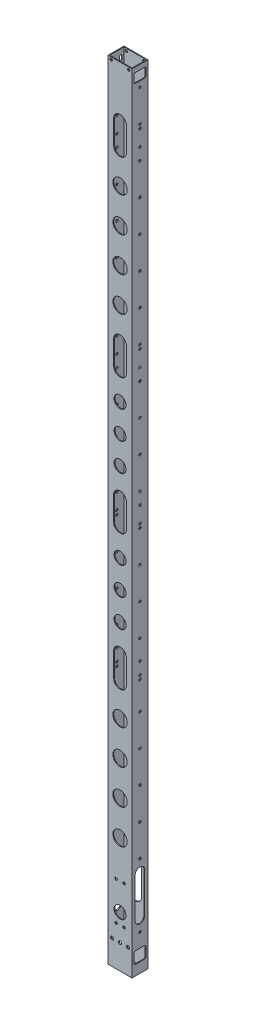
from build123d import *

# Parameters (mm, degrees)
SKETCH_1_W           = 30
SKETCH_1_H           = 20
SKETCH_1_W_2         = 28
SKETCH_1_H_2         = 18
EXTRUDE_1_DEPTH      = 980
SKETCH_3_R           = 1.5
CUT_EXTRUDE_2_DEPTH  = 981.51007134
CUT_EXTRUDE_3_DEPTH  = 981.51007134
SKETCH_5_W           = 15
SKETCH_5_H           = 12
CUT_EXTRUDE_4_DEPTH  = 10
SKETCH_6_R           = 9
SKETCH_6_R_2         = 7.5
CUT_EXTRUDE_5_DEPTH  = 981.318825689
SKETCH_9_R           = 1.5
CUT_EXTRUDE_7_DEPTH  = 981.318825689
SKETCH_13_W          = 30
SKETCH_13_H          = 20
SKETCH_13_W_2        = 28
SKETCH_13_H_2        = 18
EXTRUDE_2_DEPTH      = 10
CUT_EXTRUDE_8_DEPTH  = 60
SKETCH_15_W          = 15
SKETCH_15_H          = 15
CUT_EXTRUDE_10_DEPTH = 5
FILLET_1_R           = 2
SKETCH_16_R          = 2
CUT_EXTRUDE_11_DEPTH = 90
FILLET_2_R           = 2
SKETCH_17_R          = 1.5
CUT_EXTRUDE_12_DEPTH = 40
CUT_EXTRUDE_15_DEPTH = 51
SKETCH_21_W          = 22.187259215
SKETCH_21_H          = 65.33837704
EXTRUDE_3_DEPTH      = 1
SKETCH_22_R          = 1.65
CUT_EXTRUDE_16_DEPTH = 1
SKETCH_23_R          = 7.5
CUT_EXTRUDE_17_DEPTH = 10


with BuildPart() as part:
    # 草图1 → 凸台-拉伸1 (new body)
    with BuildSketch(Plane(origin=(0, 0, 0), x_dir=(1, 0, 0), z_dir=(0, 1, 0))):
        Rectangle(SKETCH_1_W, SKETCH_1_H)
        Rectangle(SKETCH_1_W_2, SKETCH_1_H_2, mode=Mode.SUBTRACT)
    extrude(amount=EXTRUDE_1_DEPTH)

    # 草图3 → 切除-拉伸2 (cut, through all)
    with BuildSketch(Plane(origin=(15, 0, 0), x_dir=(0, 0, -1), z_dir=(1, 0, 0))):
        with Locations((0, 890)):
            Circle(SKETCH_3_R)
        with Locations((0, 910)):
            Circle(SKETCH_3_R)
        with Locations((0, 500)):
            Circle(SKETCH_3_R)
        with Locations((0, 480)):
            Circle(SKETCH_3_R)
        with Locations((0, 670)):
            Circle(SKETCH_3_R)
        with Locations((0, 650)):
            Circle(SKETCH_3_R)
        with Locations((0, 330)):
            Circle(SKETCH_3_R)
        with Locations((0, 310)):
            Circle(SKETCH_3_R)
        with Locations((0, 70)):
            Circle(SKETCH_3_R)
        with Locations((0, 90)):
            Circle(SKETCH_3_R)
    extrude(amount=-CUT_EXTRUDE_2_DEPTH, mode=Mode.SUBTRACT)

    # 草图4 → 切除-拉伸3 (cut, through all)
    with BuildSketch(Plane(origin=(15, 0, 0), x_dir=(0, 0, -1), z_dir=(1, 0, 0))):
        with BuildLine():
            Line((3.4, 968), (3.4, 972))
            ThreePointArc((3.4, 972), (5, 973.6), (6.6, 972))
            Line((6.6, 972), (6.6, 968))
            ThreePointArc((6.6, 968), (5, 966.4), (3.4, 968))
        make_face()
        with BuildLine():
            Line((-3.4, 968), (-3.4, 972))
            ThreePointArc((-3.4, 972), (-5, 973.6), (-6.6, 972))
            Line((-6.6, 972), (-6.6, 968))
            ThreePointArc((-6.6, 968), (-5, 966.4), (-3.4, 968))
        make_face()
    extrude(amount=-CUT_EXTRUDE_3_DEPTH, mode=Mode.SUBTRACT)

    # 草图5 → 切除-拉伸4 (cut)
    with BuildSketch(Plane(origin=(15, 0, 0), x_dir=(0, 0, -1), z_dir=(1, 0, 0))):
        with Locations((0, 968)):
            Rectangle(SKETCH_5_W, SKETCH_5_H)
    extrude(amount=-CUT_EXTRUDE_4_DEPTH, mode=Mode.SUBTRACT)

    # 草图6 → 切除-拉伸5 (cut, through all)
    with BuildSketch(Plane(origin=(0, 0, -10), x_dir=(-1, 0, 0), z_dir=(0, 0, -1))):
        with Locations((0, 135)):
            Circle(SKETCH_6_R)
        with Locations((0, 178.333333333)):
            Circle(SKETCH_6_R)
        with Locations((0, 221.666666667)):
            Circle(SKETCH_6_R)
        with Locations((0, 265)):
            Circle(SKETCH_6_R)
        with Locations((0, 845)):
            Circle(SKETCH_6_R)
        with Locations((0, 801.666666667)):
            Circle(SKETCH_6_R)
        with Locations((0, 758.333333333)):
            Circle(SKETCH_6_R)
        with Locations((0, 715)):
            Circle(SKETCH_6_R)
        with Locations((0, 440)):
            Circle(SKETCH_6_R_2)
        with Locations((0, 405)):
            Circle(SKETCH_6_R_2)
        with Locations((0, 370)):
            Circle(SKETCH_6_R_2)
        with Locations((0, 610)):
            Circle(SKETCH_6_R_2)
        with Locations((0, 575)):
            Circle(SKETCH_6_R_2)
        with Locations((0, 540)):
            Circle(SKETCH_6_R_2)
        with BuildLine():
            Line((-8, 65), (-8, 95))
            ThreePointArc((-8, 95), (0, 103), (8, 95))
            Line((8, 95), (8, 65))
            ThreePointArc((8, 65), (0, 57), (-8, 65))
        make_face()
        with BuildLine():
            Line((-8, 305), (-8, 335))
            ThreePointArc((-8, 335), (0, 343), (8, 335))
            Line((8, 335), (8, 305))
            ThreePointArc((8, 305), (0, 297), (-8, 305))
        make_face()
        with BuildLine():
            Line((-8, 475), (-8, 505))
            ThreePointArc((-8, 505), (0, 513), (8, 505))
            Line((8, 505), (8, 475))
            ThreePointArc((8, 475), (0, 467), (-8, 475))
        make_face()
        with BuildLine():
            Line((-8, 645), (-8, 675))
            ThreePointArc((-8, 675), (0, 683), (8, 675))
            Line((8, 675), (8, 645))
            ThreePointArc((8, 645), (0, 637), (-8, 645))
        make_face()
        with BuildLine():
            Line((-8, 885), (-8, 915))
            ThreePointArc((-8, 915), (0, 923), (8, 915))
            Line((8, 915), (8, 885))
            ThreePointArc((8, 885), (0, 877), (-8, 885))
        make_face()
    extrude(amount=-CUT_EXTRUDE_5_DEPTH, mode=Mode.SUBTRACT)

    # 草图9 → 切除-拉伸7 (cut, through all)
    with BuildSketch(Plane.XY.offset(10)):
        with Locations((11, 977)):
            Circle(SKETCH_9_R)
        with Locations((-11, 977)):
            Circle(SKETCH_9_R)
    extrude(amount=-CUT_EXTRUDE_7_DEPTH, mode=Mode.SUBTRACT)

    # 草图13 → 凸台-拉伸2 (add)
    with BuildSketch(Plane.XZ):
        Rectangle(SKETCH_13_W, SKETCH_13_H)
        Rectangle(SKETCH_13_W_2, SKETCH_13_H_2, mode=Mode.SUBTRACT)
    extrude(amount=EXTRUDE_2_DEPTH)

    # 草图11 → 切除-拉伸8 (cut)
    with BuildSketch(Plane(origin=(-14, 0, 0), x_dir=(0, 0, -1), z_dir=(1, 0, 0))):
        with BuildLine():
            Line((-6.6, 5), (-6.6, 15))
            ThreePointArc((-6.6, 15), (-5, 16.6), (-3.4, 15))
            Line((-3.4, 15), (-3.4, 5))
            ThreePointArc((-3.4, 5), (-5, 3.4), (-6.6, 5))
        make_face()
        with BuildLine():
            Line((6.6, 5), (6.6, 15))
            ThreePointArc((6.6, 15), (5, 16.6), (3.4, 15))
            Line((3.4, 15), (3.4, 5))
            ThreePointArc((3.4, 5), (5, 3.4), (6.6, 5))
        make_face()
    extrude(amount=-CUT_EXTRUDE_8_DEPTH, mode=Mode.SUBTRACT)

    # 草图15 → 切除-拉伸10 (cut)
    with BuildSketch(Plane(origin=(15, 0, 0), x_dir=(0, 0, -1), z_dir=(1, 0, 0))):
        with Locations((0, 10)):
            Rectangle(SKETCH_15_W, SKETCH_15_H)
    extrude(amount=-CUT_EXTRUDE_10_DEPTH, mode=Mode.SUBTRACT)

    # 圆角1
    fillet_1_edges = [part.edges().sort_by_distance(p)[0] for p in [
        (14.5, 2.5, -7.5),
        (14.5, 2.5, 7.5),
        (14.5, 17.5, -7.5),
        (14.5, 17.5, 7.5),
    ]]
    fillet(fillet_1_edges, radius=FILLET_1_R)

    # 草图16 → 切除-拉伸11 (cut)
    with BuildSketch(Plane.XY.offset(10)):
        with Locations((10, 21)):
            Circle(SKETCH_16_R)
        with Locations((0, 21)):
            Circle(SKETCH_16_R)
        with Locations((-10, 21)):
            Circle(SKETCH_16_R)
    extrude(amount=-CUT_EXTRUDE_11_DEPTH, mode=Mode.SUBTRACT)

    # 圆角2
    fillet_2_edges = [part.edges().sort_by_distance(p)[0] for p in [
        (14.5, 962, -7.5),
        (14.5, 962, 7.5),
        (14.5, 974, 7.5),
        (14.5, 974, -7.5),
    ]]
    fillet(fillet_2_edges, radius=FILLET_2_R)

    # 草图17 → 切除-拉伸12 (cut)
    with BuildSketch(Plane(origin=(15, 0, 0), x_dir=(0, 0, -1), z_dir=(1, 0, 0))):
        with Locations((0, 955)):
            Circle(SKETCH_17_R)
        with Locations((0, 915)):
            Circle(SKETCH_17_R)
        with Locations((0, 875)):
            Circle(SKETCH_17_R)
        with Locations((0, 835)):
            Circle(SKETCH_17_R)
        with Locations((0, 795)):
            Circle(SKETCH_17_R)
        with Locations((0, 755)):
            Circle(SKETCH_17_R)
        with Locations((0, 715)):
            Circle(SKETCH_17_R)
        with Locations((0, 675)):
            Circle(SKETCH_17_R)
        with Locations((0, 635)):
            Circle(SKETCH_17_R)
        with Locations((0, 595)):
            Circle(SKETCH_17_R)
        with Locations((0, 555)):
            Circle(SKETCH_17_R)
        with Locations((0, 515)):
            Circle(SKETCH_17_R)
        with Locations((0, 475)):
            Circle(SKETCH_17_R)
        with Locations((0, 435)):
            Circle(SKETCH_17_R)
        with Locations((0, 395)):
            Circle(SKETCH_17_R)
        with Locations((0, 355)):
            Circle(SKETCH_17_R)
        with Locations((0, 315)):
            Circle(SKETCH_17_R)
        with Locations((0, 275)):
            Circle(SKETCH_17_R)
        with Locations((0, 235)):
            Circle(SKETCH_17_R)
        with Locations((0, 195)):
            Circle(SKETCH_17_R)
        with Locations((0, 155)):
            Circle(SKETCH_17_R)
        with Locations((0, 115)):
            Circle(SKETCH_17_R)
        with Locations((0, 75)):
            Circle(SKETCH_17_R)
        with Locations((0, 35)):
            Circle(SKETCH_17_R)
    extrude(amount=-CUT_EXTRUDE_12_DEPTH, mode=Mode.SUBTRACT)

    # 草图20 → 切除-拉伸15 (cut)
    with BuildSketch(Plane(origin=(15, 0, 0), x_dir=(0, 0, -1), z_dir=(1, 0, 0))):
        with BuildLine():
            Line((-6, 50), (-6, 100))
            ThreePointArc((-6, 100), (0, 106), (6, 100))
            Line((6, 100), (6, 50))
            ThreePointArc((6, 50), (0, 44), (-6, 50))
        make_face()
    extrude(amount=-CUT_EXTRUDE_15_DEPTH, mode=Mode.SUBTRACT)

    # 草图21 → 凸台-拉伸3 (add)
    with BuildSketch(Plane.XY.offset(10)):
        with Locations((-0.689634309, 76.201822832)):
            Rectangle(SKETCH_21_W, SKETCH_21_H)
    extrude(amount=-EXTRUDE_3_DEPTH)

    # 草图22 → 切除-拉伸16 (cut)
    with BuildSketch(Plane.XY.offset(10)):
        with Locations((5, 40)):
            Circle(SKETCH_22_R)
        with Locations((-5, 40)):
            Circle(SKETCH_22_R)
        with Locations((5, 88)):
            Circle(SKETCH_22_R)
        with Locations((-5, 88)):
            Circle(SKETCH_22_R)
    extrude(amount=-CUT_EXTRUDE_16_DEPTH, mode=Mode.SUBTRACT)

    # 草图23 → 切除-拉伸17 (cut)
    with BuildSketch(Plane.XY.offset(10)):
        with Locations((0, 54.25)):
            Circle(SKETCH_23_R)
    extrude(amount=-CUT_EXTRUDE_17_DEPTH, mode=Mode.SUBTRACT)


solid = part.part
